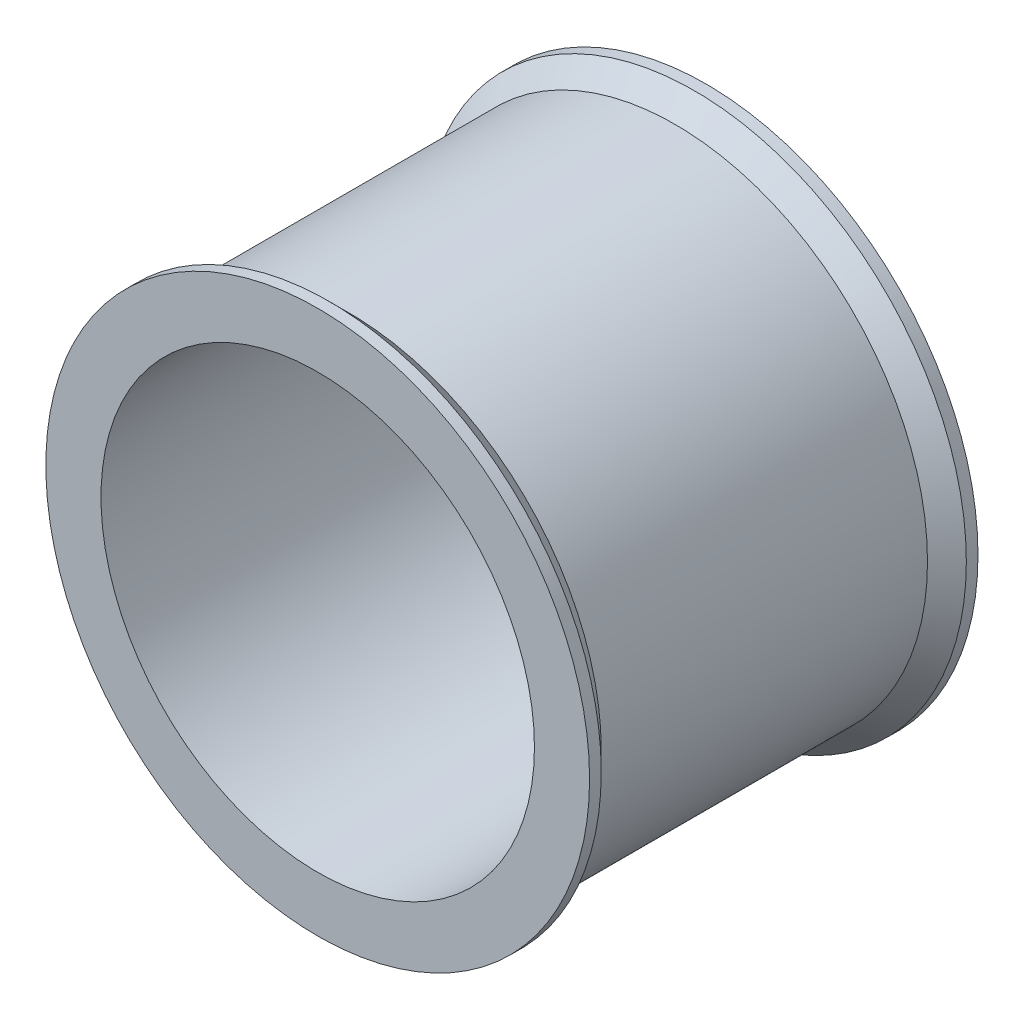
from build123d import *

# Parameters (mm, degrees)
SKETCH1_R           = 6.5
SKETCH1_R_2         = 5.58
BOSS_EXTRUDE1_DEPTH = 5
BOSS_EXTRUDE2_START = 1
SKETCH2_R           = 7
SKETCH2_R_2         = 6.5
BOSS_EXTRUDE2_DEPTH = 1
CHAMFER1_SIZE       = 0.7


with BuildPart() as part:
    # Sketch1 → Boss-Extrude1 (new, symmetric)
    with BuildSketch(Plane.XY):
        Circle(SKETCH1_R)
        Circle(SKETCH1_R_2, mode=Mode.SUBTRACT)
    extrude(amount=BOSS_EXTRUDE1_DEPTH, both=True)

    # Sketch2 → Boss-Extrude2 (add)
    with BuildSketch(Plane.XY.offset(-5).offset(BOSS_EXTRUDE2_START)):
        Circle(SKETCH2_R)
        Circle(SKETCH2_R_2, mode=Mode.SUBTRACT)
    boss_extrude2 = extrude(amount=-BOSS_EXTRUDE2_DEPTH)

    # Mirror1: Boss-Extrude2 across plane
    add(boss_extrude2.mirror(Plane.XY))

    # Chamfer1
    # the kernel refuses this chamfer: 0.7 mm, written as the material it takes off along each edge
    with BuildSketch(Plane(origin=(0, 0, 4), x_dir=(1, 0, 0), z_dir=(0, -1, 0))) as chamfer1_piece_1_section:
        Polygon((7 - CHAMFER1_SIZE, 0), (7, CHAMFER1_SIZE), (7, 0), align=None)
    chamfer1_piece_1 = revolve(axis=Axis((0, 0, 4), (0, 0, 1)), mode=Mode.PRIVATE)
    chamfer1_piece_1 = chamfer1_piece_1 - Plane(origin=(0, 0, 4.444446297), x_dir=(1, 0, 0), z_dir=(0, 0, 1)) * Cylinder(6.5, 29, mode=Mode.PRIVATE)
    add(chamfer1_piece_1, mode=Mode.SUBTRACT)
    with BuildSketch(Plane(origin=(0, 0, -4), x_dir=(1, 0, 0), z_dir=(0, -1, 0))) as chamfer1_piece_2_section:
        Polygon((7 - CHAMFER1_SIZE, 0), (7, -CHAMFER1_SIZE), (7, 0), align=None)
    chamfer1_piece_2 = revolve(axis=Axis((0, 0, -4), (0, 0, 1)), mode=Mode.PRIVATE)
    chamfer1_piece_2 = chamfer1_piece_2 - Plane(origin=(0, 0, -4.444446297), x_dir=(1, 0, 0), z_dir=(0, 0, 1)) * Cylinder(6.5, 29, mode=Mode.PRIVATE)
    add(chamfer1_piece_2, mode=Mode.SUBTRACT)


solid = part.part
